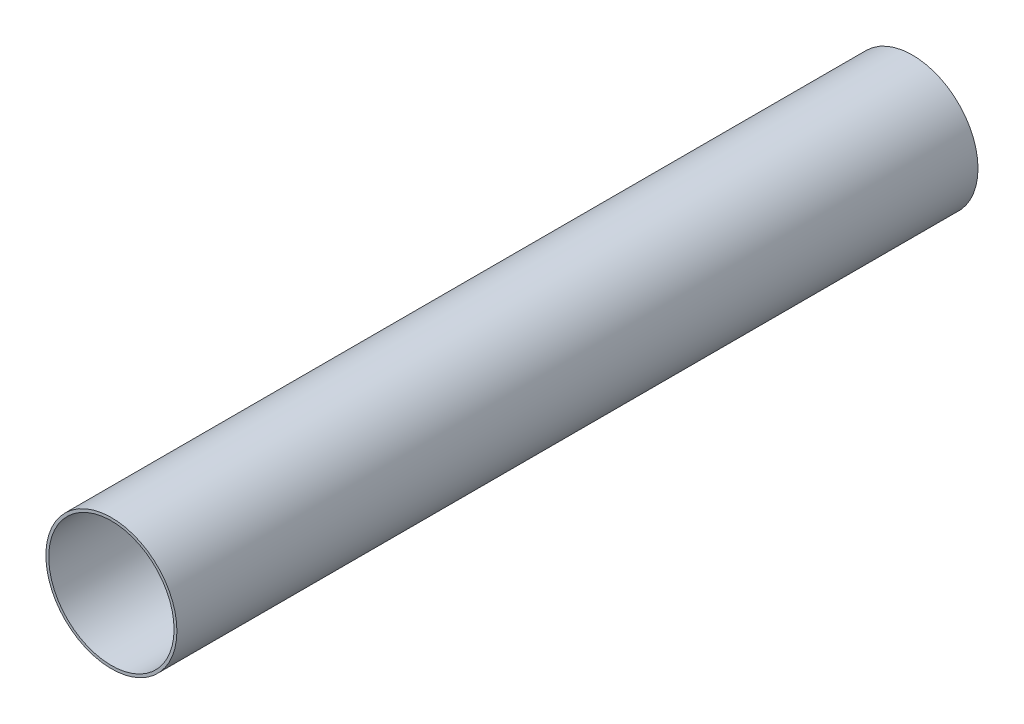
from build123d import *

# Parameters (mm, degrees)
SKETCH1_R           = 28.625
BOSS_EXTRUDE3_DEPTH = 350
CUT_EXTRUDE2_REACH  = 354.333
SKETCH4_R           = 27.375


with BuildPart() as part:
    # Sketch1 → Boss-Extrude3 (new body)
    with BuildSketch(Plane.XY):
        Circle(SKETCH1_R)
    extrude(amount=-BOSS_EXTRUDE3_DEPTH)

    # Sketch4 → Cut-Extrude2 (cut, up to next)
    with BuildSketch(Plane.XY, mode=Mode.PRIVATE) as cut_extrude2_sk1:
        Circle(SKETCH4_R)
    cut_extrude2_tool1 = extrude(cut_extrude2_sk1.sketch, amount=-CUT_EXTRUDE2_REACH, mode=Mode.PRIVATE) & part.part
    add(cut_extrude2_tool1.solids().sort_by_distance((0, 0, 0))[0], mode=Mode.SUBTRACT)


solid = part.part
